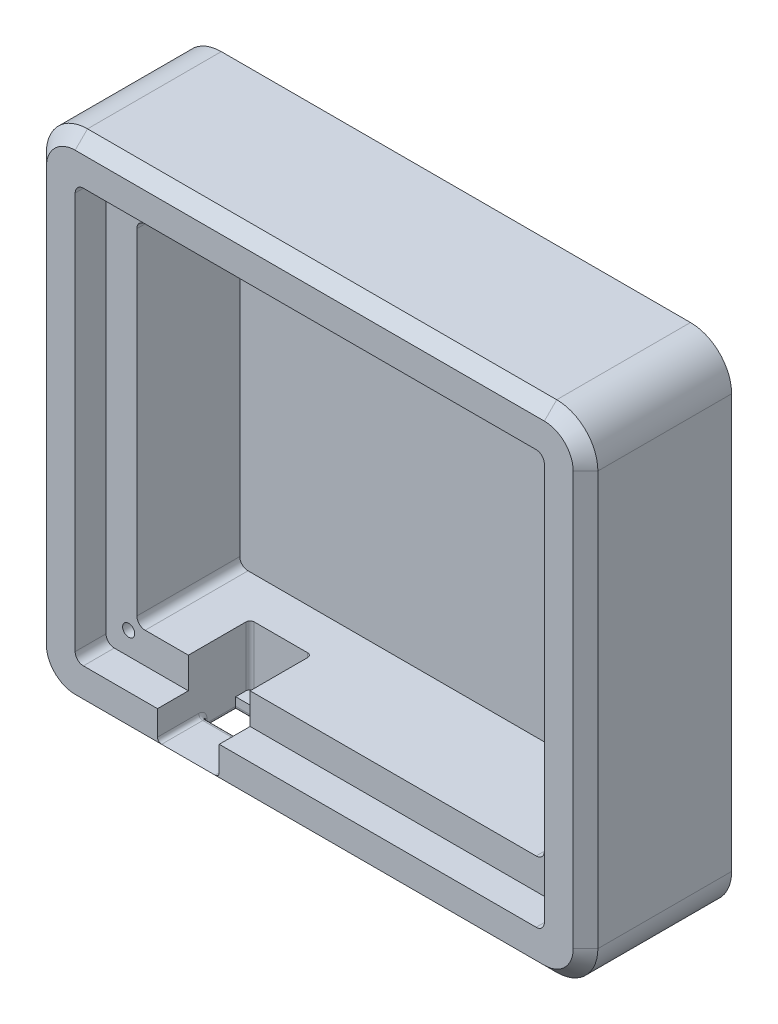
from build123d import *

# Parameters (mm, degrees)
BASE_W              = 134
BASE_H              = 120.5
BASE_W_2            = 114
BASE_H_2            = 100.5
BASE_R              = 1.475
BASE_W_3            = 99
BASE_H_3            = 85.5
BOSS_EXTRUDE1_DEPTH = 3
BOSS_EXTRUDE2_START = 3
BASE_3_W            = 114
BASE_3_H            = 100.5
BASE_3_R            = 1.475
BASE_3_W_2          = 99
BASE_3_H_2          = 85.5
BOSS_EXTRUDE2_DEPTH = 25
BOSS_EXTRUDE3_START = 3
BASE_4_W            = 134
BASE_4_H            = 120.5
BASE_4_W_2          = 114
BASE_4_H_2          = 100.5
BOSS_EXTRUDE3_DEPTH = 32.5
SKETCH2_W           = 15
SKETCH2_H           = 14.5
CUT_EXTRUDE1_DEPTH  = 22.5
SKETCH3_W           = 15
SKETCH3_H           = 8
CUT_EXTRUDE2_DEPTH  = 3
FILLET1_R           = 10
FILLET2_R           = 2
FILLET3_R           = 1
CHAMFER1_SIZE       = 3


with BuildPart() as part:
    # Base → Boss-Extrude1 (new body)
    # profile 1 of 7: a face of its own
    with BuildSketch(Plane.XY):
        Rectangle(BASE_W, BASE_H)
        Rectangle(BASE_W_2, BASE_H_2, mode=Mode.SUBTRACT)
    # profile 2 of 7: a face of its own
    with BuildSketch(Plane.XY):
        Rectangle(BASE_W_2, BASE_H_2)
        with Locations((-51.5, -44.75)):
            Circle(BASE_R, mode=Mode.SUBTRACT)
        with Locations((51.5, -44.75)):
            Circle(BASE_R, mode=Mode.SUBTRACT)
        with Locations((51.5, 44.75)):
            Circle(BASE_R, mode=Mode.SUBTRACT)
        with Locations((-51.5, 44.75)):
            Circle(BASE_R, mode=Mode.SUBTRACT)
        Rectangle(BASE_W_3, BASE_H_3, mode=Mode.SUBTRACT)
    # profile 3 of 7: a face of its own
    with BuildSketch(Plane.XY):
        with Locations((51.5, -44.75)):
            Circle(BASE_R)
    # profile 4 of 7: a face of its own
    with BuildSketch(Plane.XY):
        with Locations((-51.5, 44.75)):
            Circle(BASE_R)
    # profile 5 of 7: a face of its own
    with BuildSketch(Plane.XY):
        with Locations((-51.5, -44.75)):
            Circle(BASE_R)
    # profile 6 of 7: a face of its own
    with BuildSketch(Plane.XY):
        with Locations((51.5, 44.75)):
            Circle(BASE_R)
    # profile 7 of 7: a face of its own
    with BuildSketch(Plane.XY):
        Rectangle(BASE_W_3, BASE_H_3)
    extrude(amount=BOSS_EXTRUDE1_DEPTH)

    # Base<3> → Boss-Extrude2 (add)
    with BuildSketch(Plane.XY.offset(BOSS_EXTRUDE2_START)):
        Rectangle(BASE_3_W, BASE_3_H)
        with Locations((-51.5, -44.75)):
            Circle(BASE_3_R, mode=Mode.SUBTRACT)
        with Locations((51.5, -44.75)):
            Circle(BASE_3_R, mode=Mode.SUBTRACT)
        with Locations((51.5, 44.75)):
            Circle(BASE_3_R, mode=Mode.SUBTRACT)
        with Locations((-51.5, 44.75)):
            Circle(BASE_3_R, mode=Mode.SUBTRACT)
        Rectangle(BASE_3_W_2, BASE_3_H_2, mode=Mode.SUBTRACT)
    extrude(amount=BOSS_EXTRUDE2_DEPTH)

    # Base<4> → Boss-Extrude3 (add)
    with BuildSketch(Plane.XY.offset(BOSS_EXTRUDE3_START)):
        Rectangle(BASE_4_W, BASE_4_H)
        Rectangle(BASE_4_W_2, BASE_4_H_2, mode=Mode.SUBTRACT)
    extrude(amount=BOSS_EXTRUDE3_DEPTH)

    # Sketch2 → Cut-Extrude1 (cut)
    with BuildSketch(Plane.XY.offset(35.5)):
        with Locations((-29.5, -50)):
            Rectangle(SKETCH2_W, SKETCH2_H)
    extrude(amount=-CUT_EXTRUDE1_DEPTH, mode=Mode.SUBTRACT)

    # Sketch3 → Cut-Extrude2 (cut)
    with BuildSketch(Plane.XZ.offset(60.25)):
        with Locations((-29.5, 20.5)):
            Rectangle(SKETCH3_W, SKETCH3_H)
    extrude(amount=-CUT_EXTRUDE2_DEPTH, mode=Mode.SUBTRACT)

    # Fillet1
    fillet1_edges = [part.edges().sort_by_distance(p)[0] for p in [
        (67, 60.25, 17.75),
        (67, -60.25, 17.75),
        (-67, -60.25, 17.75),
        (-67, 60.25, 17.75),
    ]]
    fillet(fillet1_edges, radius=FILLET1_R)

    # Fillet2
    fillet2_edges = [part.edges().sort_by_distance(p)[0] for p in [
        (49.5, -42.75, 15.5),
        (49.5, 42.75, 15.5),
        (-49.5, 42.75, 15.5),
        (-49.5, -42.75, 15.5),
        (57, 50.25, 31.75),
        (-57, -50.25, 31.75),
        (57, -50.25, 31.75),
        (-57, 50.25, 31.75),
    ]]
    fillet(fillet2_edges, radius=FILLET2_R)

    # Fillet3
    fillet3_edges = [part.edges().sort_by_distance(p)[0] for p in [
        (-22, -57.25, 30),
        (-37, -57.25, 30),
        (-37, -60.25, 20.5),
        (-22, -60.25, 20.5),
        (-29.5, -57.25, 24.5),
        (-37, -58.75, 24.5),
        (-29.5, -60.25, 24.5),
        (-22, -58.75, 24.5),
        (-37, -50, 13),
        (-22, -50, 13),
        (-29.5, -60.25, 16.5),
    ]]
    fillet(fillet3_edges, radius=FILLET3_R)

    # Chamfer1
    chamfer1_edges = [part.edges().sort_by_distance(p)[0] for p in [
        (0, 60.25, 35.5),
        (67, 0, 35.5),
        (0, -60.25, 35.5),
        (-67, 0, 35.5),
        (64.071067812, -57.321067812, 35.5),
        (-64.071067812, -57.321067812, 35.5),
        (-64.071067812, 57.321067812, 35.5),
        (64.071067812, 57.321067812, 35.5),
    ]]
    chamfer(chamfer1_edges, length=CHAMFER1_SIZE - 0.0001)  # a hair under: the kernel refuses the full size


solid = part.part
